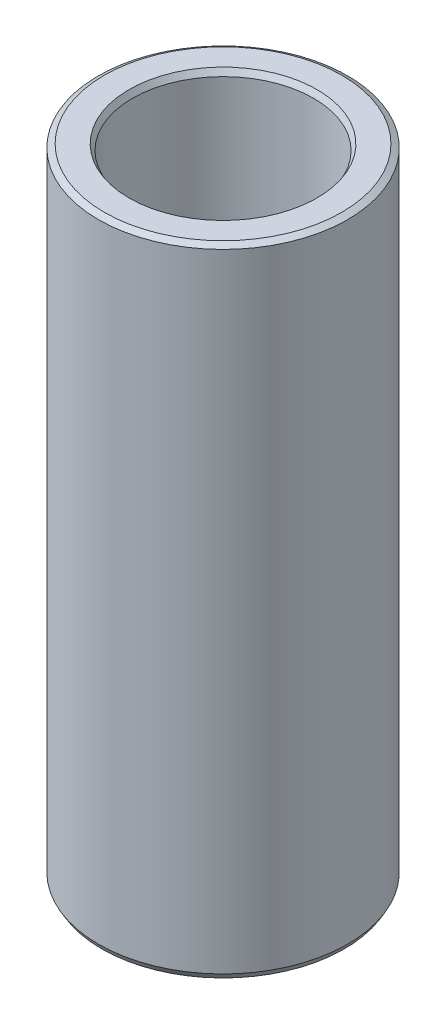
from build123d import *
from OCP.BRepFilletAPI import BRepFilletAPI_MakeChamfer

# Parameters (mm, degrees)
SKETCH1_R           = 60
BOSS_EXTRUDE1_DEPTH = 306.568059546
SKETCH2_R           = 43.604962766
CUT_EXTRUDE1_DEPTH  = 319.094286547
CHAMFER1_SIZE       = 1.629995501
CHAMFER1_SIZE2      = 2.823235025


with BuildPart() as part:
    # Sketch1 → Boss-Extrude1 (new body)
    with BuildSketch(Plane(origin=(0, 0, 0), x_dir=(1, 0, 0), z_dir=(0, 1, 0))):
        Circle(SKETCH1_R)
    extrude(amount=BOSS_EXTRUDE1_DEPTH)

    # Sketch2 → Cut-Extrude1 (cut, through all)
    with BuildSketch(Plane(origin=(0, 0, 0), x_dir=(1, 0, 0), z_dir=(0, 1, 0))):
        Circle(SKETCH2_R)
    extrude(amount=CUT_EXTRUDE1_DEPTH, mode=Mode.SUBTRACT)

    # Chamfer1: one chamfer whose edges measure the first distance from different faces: ONE call of the kernel's chamfer builder (chamfer() names one face for all edges)
    chamfer1_edges_1 = [part.edges().sort_by_distance(p)[0] for p in [
        (-43.604962766, 306.568059546, 0),
    ]]
    chamfer1_side_1 = [part.faces().sort_by_distance(p)[0] for p in [
        (-58.302943725, 306.568059546, 0),
    ]]
    chamfer1_edges_2 = [part.edges().sort_by_distance(p)[0] for p in [
        (-43.604962766, 0, 0),
    ]]
    chamfer1_side_2 = [part.faces().sort_by_distance(p)[0] for p in [
        (-43.604962766, 153.284029773, 0),
    ]]
    chamfer1_edges_3 = [part.edges().sort_by_distance(p)[0] for p in [
        (-60, 0, 0),
    ]]
    chamfer1_side_3 = [part.faces().sort_by_distance(p)[0] for p in [
        (-58.302943725, 0, 0),
    ]]
    chamfer1_edges_4 = [part.edges().sort_by_distance(p)[0] for p in [
        (-60, 306.568059546, 0),
    ]]
    chamfer1_side_4 = [part.faces().sort_by_distance(p)[0] for p in [
        (-60, 153.284029773, 0),
    ]]
    chamfer1 = BRepFilletAPI_MakeChamfer(part.part.solid().wrapped)
    for e in chamfer1_edges_1:
        chamfer1.Add(CHAMFER1_SIZE, CHAMFER1_SIZE2, e.wrapped, chamfer1_side_1[0].wrapped)  # the first distance lies on this face
    for e in chamfer1_edges_2:
        chamfer1.Add(CHAMFER1_SIZE, CHAMFER1_SIZE2, e.wrapped, chamfer1_side_2[0].wrapped)  # the first distance lies on this face
    for e in chamfer1_edges_3:
        chamfer1.Add(CHAMFER1_SIZE, CHAMFER1_SIZE2, e.wrapped, chamfer1_side_3[0].wrapped)  # the first distance lies on this face
    for e in chamfer1_edges_4:
        chamfer1.Add(CHAMFER1_SIZE, CHAMFER1_SIZE2, e.wrapped, chamfer1_side_4[0].wrapped)  # the first distance lies on this face
    add(Compound.cast(chamfer1.Shape()), mode=Mode.REPLACE)


solid = part.part
